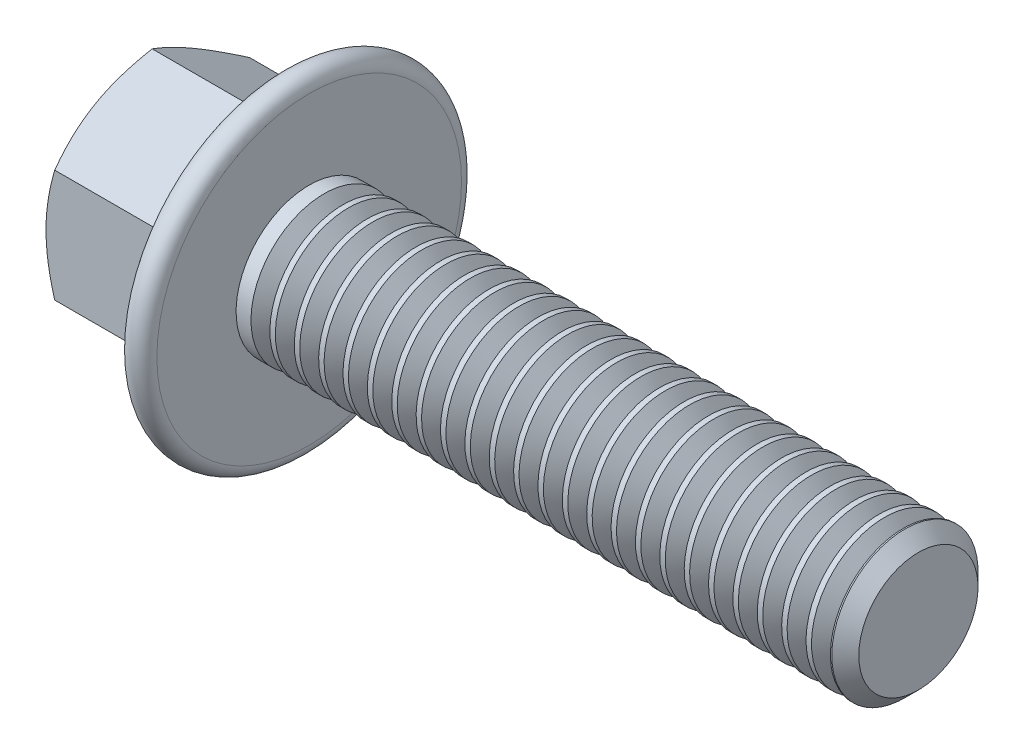
from build123d import *

# Parameters (mm, degrees)
BASEHEAD_DEPTH    = 6.8
FLANGEHEXFILLET_R = 0.11
THDSCHPAT_COUNT   = 24
THDSCHPAT_PITCH   = 1


# Read off the part's stored shape, not the designer's step: HeadChamfer
with BuildPart() as part:
    # Sketch1 → BaseHead (new body)
    with BuildSketch(Plane(origin=(0, 0, 0), x_dir=(0, 0, -1), z_dir=(1, 0, 0))):
        Polygon((4, 2.309401077), (4, -2.309401077), (0, -4.618802154), (-4, -2.309401077), (-4, 2.309401077), (0, 4.618802154), align=None)
    extrude(amount=BASEHEAD_DEPTH)

    # HeadChamfer outline → HeadChamfer (revolve, cut)
    with BuildSketch(Plane.YX):
        Polygon((4.618802148, 0.357265587), (3.999999382, -3.57e-07), (4.618802154, -3.57e-07), align=None)
    revolve(axis=Axis((0, 0, 0), (1, 0, 0)), mode=Mode.SUBTRACT)

    # HeadChamfer 2 outline → HeadChamfer 2 (revolve)
    with BuildSketch(Plane.YX):
        Polygon((3, 6.8), (3, 31.2455), (2.4455, 31.8), (0, 31.8), (0, 6.8), align=None)
    revolve(axis=Axis((0, 0, 0), (1, 0, 0)))

    # Sketch4 → Flange (revolve)
    with BuildSketch(Plane.XY, mode=Mode.PRIVATE) as flange_sk:
        with BuildLine():
            Line((3.389888261, 0), (5.733169059, 6.438111079))
            ThreePointArc((5.733169059, 6.438111079), (6.345506498, 6.791644264), (6.8, 6.25))
            Line((6.8, 6.25), (6.8, 0))
            Line((6.8, 0), (3.389888261, 0))
        make_face()
    revolve(flange_sk.sketch.rotate(Axis((0, 0, 0), (1, 0, 0)), 90), axis=Axis((0, 0, 0), (1, 0, 0)))

    # FlangeHexFillet
    flangehexfillet_edges = [part.edges().sort_by_distance(p)[0] for p in [
        (4.845769198, 0, -4),
        (4.845769198, -3.464101615, -2),
        (4.905726696, 1.159737717, 4),
        (4.845769198, 3.464101615, 2),
        (4.845769198, 3.464101615, -2),
        (4.845769198, -3.464101615, 2),
        (4.905726696, -1.159737717, 4),
    ]]
    fillet(flangehexfillet_edges, radius=FLANGEHEXFILLET_R)

    # ThdSchSke → ThreadSchematic (revolve, cut)
    with BuildSketch(Plane.XY):
        Polygon((7.8, -2.4455), (7.41173492, -3), (7.41173492, -3.75), (8.18826508, -3.75), (8.18826508, -3), align=None)
    threadschematic = revolve(axis=Axis((-3.175, 0, 0), (1, 0, 0)), mode=Mode.SUBTRACT)

    # ThdSchPat: ThreadSchematic ×24
    with Locations(*[(i * THDSCHPAT_PITCH, 0, 0) for i in range(1, THDSCHPAT_COUNT)]):
        add(threadschematic, mode=Mode.SUBTRACT)


solid = part.part
